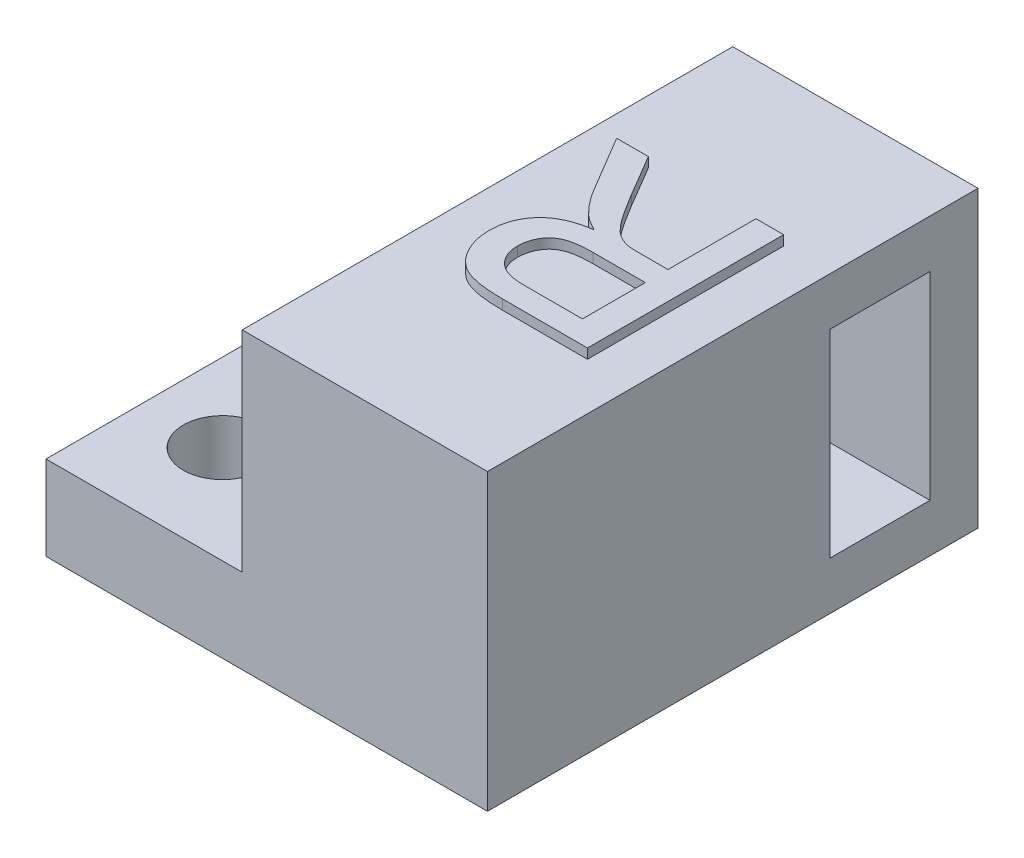
from build123d import *

# Parameters (mm, degrees)
SKETCH1_W           = 25
SKETCH1_H           = 50
BOSS_EXTRUDE1_DEPTH = 30
SKETCH2_W           = 50
SKETCH2_H           = 8.605036789
BOSS_EXTRUDE2_DEPTH = 20
SKETCH3_R           = 4
CUT_EXTRUDE1_DEPTH  = 47.249264327
SKETCH4_W           = 10.2
SKETCH4_H           = 20.2
CUT_EXTRUDE2_DEPTH  = 20
BOSS_EXTRUDE3_DEPTH = 1


with BuildPart() as part:
    # Sketch1 → Boss-Extrude1 (new body)
    with BuildSketch(Plane(origin=(0, 0, 0), x_dir=(1, 0, 0), z_dir=(0, 1, 0))):
        Rectangle(SKETCH1_W, SKETCH1_H)
    extrude(amount=BOSS_EXTRUDE1_DEPTH)

    # Sketch2 → Boss-Extrude2 (add)
    with BuildSketch(Plane.ZY.offset(12.5)):
        with Locations((0, 4.302518394)):
            Rectangle(SKETCH2_W, SKETCH2_H)
    extrude(amount=BOSS_EXTRUDE2_DEPTH)

    # Sketch3 → Cut-Extrude1 (cut, through all)
    with BuildSketch(Plane(origin=(0, 8.605036789, 0), x_dir=(1, 0, 0), z_dir=(0, 1, 0))):
        with Locations((-24.5, 15)):
            Circle(SKETCH3_R)
        with Locations((-24.5, -15)):
            Circle(SKETCH3_R)
    extrude(amount=-CUT_EXTRUDE1_DEPTH, mode=Mode.SUBTRACT)

    # Sketch4 → Cut-Extrude2 (cut)
    with BuildSketch(Plane(origin=(12.5, 0, 0), x_dir=(0, 0, -1), z_dir=(1, 0, 0))):
        with Locations((15, 15)):
            Rectangle(SKETCH4_W, SKETCH4_H)
    extrude(amount=-CUT_EXTRUDE2_DEPTH, mode=Mode.SUBTRACT)

    # Sketch5 → Boss-Extrude3 (add)
    with BuildSketch(Plane(origin=(0, 30, 0), x_dir=(1, 0, 0), z_dir=(0, 1, 0))):
        with BuildLine():
            Line((7.692307692, 10), (7.692307692, -10))
            Line((7.692307692, -10), (-0.985576923, -10))
            add(Edge.make_bspline(
                [(-0.985576923, -10), (-1.189915508, -9.998406517), (-1.585388921, -9.995322517), (-2.158891161, -9.97328499), (-2.692933181, -9.926466249), (-3.190880742, -9.87417544), (-3.651881782, -9.796967041), (-4.076156001, -9.706387661), (-4.462076213, -9.599333368), (-4.812578849, -9.472790754), (-5.13779529, -9.329673653), (-5.439160579, -9.1529927), (-5.729614752, -8.959721513), (-5.997579665, -8.730765608), (-6.255124362, -8.484777239), (-6.491466209, -8.20944831), (-6.713599726, -7.911670049), (-6.98368474, -7.480457665), (-7.26734754, -6.902448182), (-7.511671117, -6.168093018), (-7.667028651, -5.399134972), (-7.683798939, -4.873873893), (-7.692307692, -4.607371795)],
                knots=[0, 0, 0, 0, 1.242075696, 2.40389213, 3.487198984, 4.500157661, 5.446319301, 6.326791195, 7.136300648, 7.878370406, 8.590488565, 9.292260633, 9.999224673, 10.708050372, 11.431369221, 12.162165018, 12.910600795, 13.687589445, 15.252257874, 16.810406251, 18.381693487, 20, 20, 20, 20], degree=3))
            add(Edge.make_bspline(
                [(-7.692307692, -4.607371795), (-7.688394011, -4.436288612), (-7.680664221, -4.098387595), (-7.621454116, -3.601582104), (-7.51431592, -3.126906532), (-7.376939813, -2.670193942), (-7.1888858, -2.237951011), (-6.971132957, -1.821215885), (-6.700987613, -1.431932834), (-6.399355855, -1.057091635), (-6.048612719, -0.71360816), (-5.658467411, -0.39614679), (-5.217190586, -0.123711561), (-4.739255324, 0.129469087), (-4.212344466, 0.337396306), (-3.644404331, 0.520482963), (-3.031039376, 0.661647942), (-2.605906991, 0.732754289), (-2.387820513, 0.769230769)],
                knots=[0, 0, 0, 0, 0.982645791, 1.940792824, 2.867691729, 3.775150443, 4.675643875, 5.571354211, 6.471357401, 7.392684514, 8.331098131, 9.285922955, 10.275520706, 11.304845665, 12.388884831, 13.524255008, 14.729980297, 16, 16, 16, 16], degree=3))
            add(Edge.make_bspline(
                [(-2.387820513, 0.769230769), (-2.549345996, 0.849743746), (-2.855664626, 1.002429402), (-3.272498706, 1.255059029), (-3.637663897, 1.492888205), (-3.845092801, 1.671226556), (-3.942307692, 1.754807692)],
                knots=[0, 0, 0, 0, 1.172551213, 2.223638478, 3.167479604, 4, 4, 4, 4], degree=3))
            add(Edge.make_bspline(
                [(-3.942307692, 1.754807692), (-4.131560958, 1.939760877), (-4.519688241, 2.319069404), (-5.049338611, 2.971134565), (-5.573421338, 3.688219618), (-5.888069662, 4.2107727), (-6.049679487, 4.479166667)],
                knots=[0, 0, 0, 0, 0.918170575, 1.883016652, 2.912673989, 4, 4, 4, 4], degree=3))
            Line((-6.049679487, 4.479166667), (-9.330929487, 10))
            Line((-9.330929487, 10), (-6.09775641, 10))
            Line((-6.09775641, 10), (-3.605769231, 5.77724359))
            add(Edge.make_bspline(
                [(-3.605769231, 5.77724359), (-3.516164402, 5.629086783), (-3.342524957, 5.34198322), (-3.091798881, 4.922621923), (-2.845639404, 4.536751784), (-2.618440056, 4.172360633), (-2.395792195, 3.839058208), (-2.196203285, 3.524230537), (-1.99576396, 3.245712753), (-1.765615132, 2.91110533), (-1.484546035, 2.549334189), (-1.156558274, 2.177690005), (-0.854995349, 1.869836465), (-0.473923576, 1.576103263), (-8.0808e-05, 1.307161834), (0.399436219, 1.179583217), (0.592948718, 1.117788462)],
                knots=[0, 0, 0, 0, 1.130591283, 2.190900266, 3.190104209, 4.119071823, 4.994606968, 5.807262858, 6.55236009, 7.234593472, 8.459046683, 9.540234366, 10.471327768, 11.266723835, 12.676093724, 14, 14, 14, 14], degree=3))
            add(Edge.make_bspline(
                [(0.592948718, 1.117788462), (0.674242958, 1.103128347), (0.859840146, 1.069658866), (1.174983707, 1.047799895), (1.556818794, 1.024599522), (1.833541189, 1.025275503), (1.983173077, 1.025641026)],
                knots=[0, 0, 0, 0, 0.709978628, 1.620902492, 2.713552433, 4, 4, 4, 4], degree=3))
            Line((1.983173077, 1.025641026), (4.871794872, 1.025641026))
            Line((4.871794872, 1.025641026), (4.871794872, 10))
            Line((4.871794872, 10), (7.692307692, 10))
        make_face()
        with BuildLine():
            Line((4.871794872, -1.282051282), (-0.484775641, -1.282051282))
            add(Edge.make_bspline(
                [(-0.484775641, -1.282051282), (-0.753386517, -1.286217416), (-1.255529355, -1.294005613), (-1.957518176, -1.361528247), (-2.558000395, -1.467075801), (-3.064646298, -1.627384754), (-3.490432782, -1.842070076), (-3.859462924, -2.104609449), (-4.169752828, -2.430321342), (-4.424939479, -2.80379836), (-4.624425797, -3.210810832), (-4.763816724, -3.641583566), (-4.857398907, -4.087856282), (-4.866967535, -4.393220511), (-4.871794872, -4.547275641)],
                knots=[0, 0, 0, 0, 1.546056516, 2.890207646, 4.055830773, 5.050253158, 5.937355789, 6.790906573, 7.644595853, 8.512568064, 9.38593768, 10.244184789, 11.114197691, 12, 12, 12, 12], degree=3))
            add(Edge.make_bspline(
                [(-4.871794872, -4.547275641), (-4.868088958, -4.659544766), (-4.86083016, -4.879447), (-4.822372143, -5.202097101), (-4.749202425, -5.50786025), (-4.648165007, -5.798940542), (-4.520236894, -6.075969951), (-4.363033481, -6.337858904), (-4.177365929, -6.583269781), (-3.964383478, -6.81341075), (-3.719926868, -7.02284832), (-3.440676061, -7.203538998), (-3.128860999, -7.357089463), (-2.784111469, -7.478956731), (-2.407515729, -7.576430897), (-1.996929252, -7.641277267), (-1.554229928, -7.688199899), (-1.24746496, -7.690912847), (-1.08974359, -7.692307692)],
                knots=[0, 0, 0, 0, 0.965235723, 1.89061323, 2.787065514, 3.661873922, 4.534873316, 5.404925039, 6.281839248, 7.175200054, 8.095223355, 9.040740021, 10.02630299, 11.075573487, 12.177989335, 13.364883635, 14.645170704, 16, 16, 16, 16], degree=3))
            Line((-1.08974359, -7.692307692), (4.871794872, -7.692307692))
            Line((4.871794872, -7.692307692), (4.871794872, -1.282051282))
        make_face(mode=Mode.SUBTRACT)
    extrude(amount=BOSS_EXTRUDE3_DEPTH)


solid = part.part
